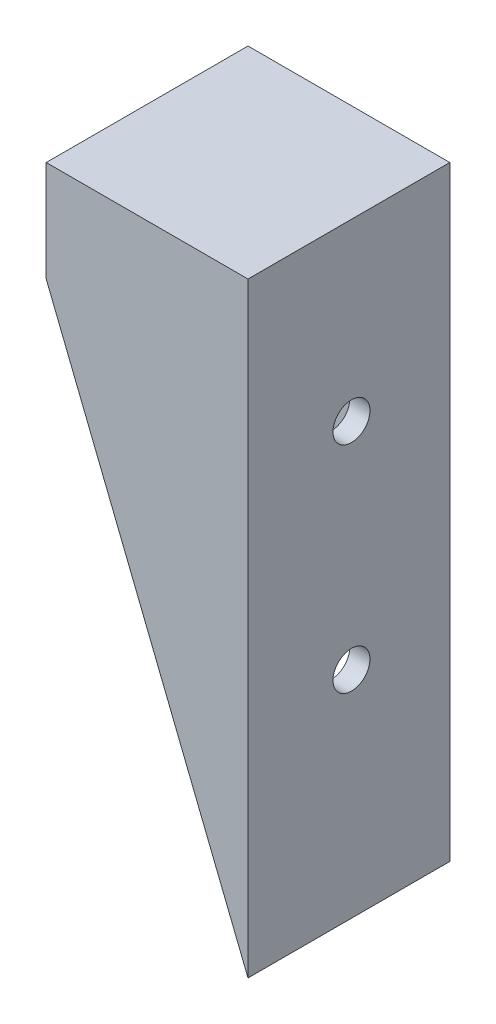
from build123d import *

# Parameters (mm, degrees)
EXTRUDE_1_DEPTH     = 30
SKETCH_2_W          = 20
SKETCH_2_H          = 50
CUT_EXTRUDE_1_DEPTH = 27
SKETCH_3_R          = 2.75
CUT_EXTRUDE_2_DEPTH = 81.31017744


with BuildPart() as part:
    # 草圖1 → 填料-伸長1 (new body)
    with BuildSketch(Plane.XY):
        Polygon((-18.940316301, 5.568561873), (11.059683699, -69.431438127), (11.059683699, 20.568561873), (-18.940316301, 20.568561873), align=None)
    extrude(amount=EXTRUDE_1_DEPTH)

    # 草圖2 → 除料-伸長1 (cut)
    with BuildSketch(Plane.ZY.offset(18.940316301)):
        with Locations((15, -23.128650339)):
            Rectangle(SKETCH_2_W, SKETCH_2_H)
    extrude(amount=-CUT_EXTRUDE_1_DEPTH, mode=Mode.SUBTRACT)

    # 草圖3 → 除料-伸長2 (cut, through all)
    with BuildSketch(Plane.ZY.offset(-8.059683699)):
        with Locations((14.616854651, -5.431438127)):
            Circle(SKETCH_3_R)
        with Locations((14.616854651, -37.431438127)):
            Circle(SKETCH_3_R)
    extrude(amount=-CUT_EXTRUDE_2_DEPTH, mode=Mode.SUBTRACT)


solid = part.part
